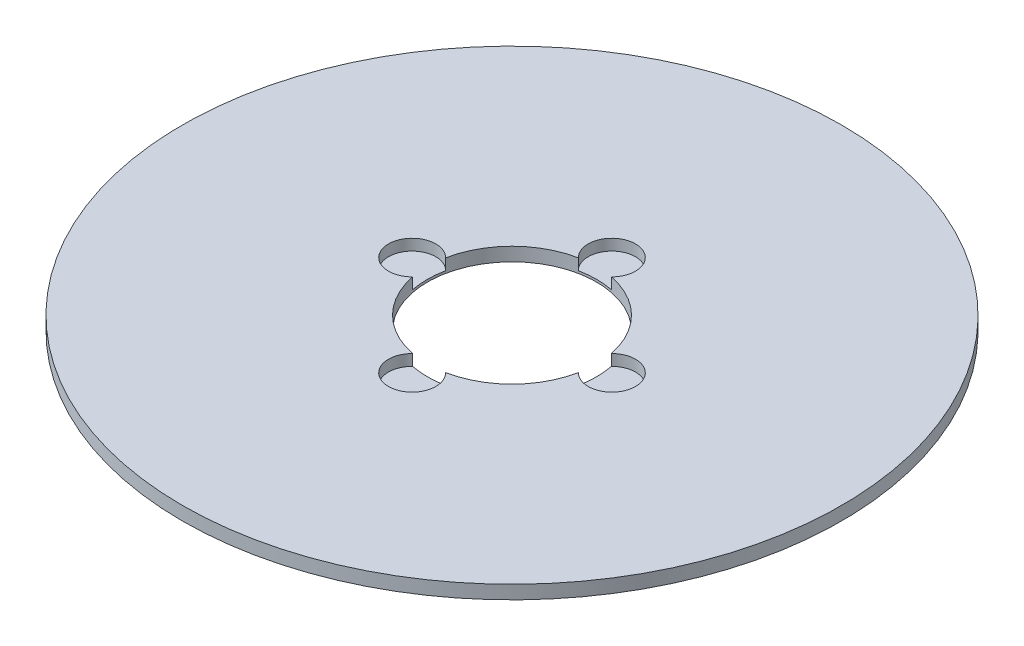
from build123d import *

# Parameters (mm, degrees)
SKETCH1_R           = 97.5
BOSS_EXTRUDE1_DEPTH = 4
SKETCH2_R           = 25
CUT_EXTRUDE1_DEPTH  = 138.943829148
SKETCH3_R           = 7.000089202
CUT_EXTRUDE2_DEPTH  = 3.292116242
CIRPATTERN1_COUNT   = 4


with BuildPart() as part:
    # Sketch1 → Boss-Extrude1 (new body)
    with BuildSketch(Plane(origin=(0, 0, 0), x_dir=(1, 0, 0), z_dir=(0, 1, 0))):
        Circle(SKETCH1_R)
    extrude(amount=BOSS_EXTRUDE1_DEPTH)

    # Sketch2 → Cut-Extrude1 (cut, through all)
    with BuildSketch(Plane(origin=(0, 0, 0), x_dir=(1, 0, 0), z_dir=(0, 1, 0))):
        Circle(SKETCH2_R)
    extrude(amount=CUT_EXTRUDE1_DEPTH, mode=Mode.SUBTRACT)

    # Sketch3 → Cut-Extrude2 (cut)
    with BuildSketch(Plane(origin=(0, 4, 0), x_dir=(1, 0, 0), z_dir=(0, 1, 0))):
        with Locations((-29.540469542, 0)):
            Circle(SKETCH3_R)
    cut_extrude2 = extrude(amount=-CUT_EXTRUDE2_DEPTH, mode=Mode.SUBTRACT)

    # CirPattern1: Cut-Extrude2 ×4 about axis
    cirpattern1_axis = Axis((0, 0, 0), (0, 1, 0))
    for i in range(1, CIRPATTERN1_COUNT):
        add(cut_extrude2.rotate(cirpattern1_axis, i * 360 / CIRPATTERN1_COUNT), mode=Mode.SUBTRACT)


solid = part.part
